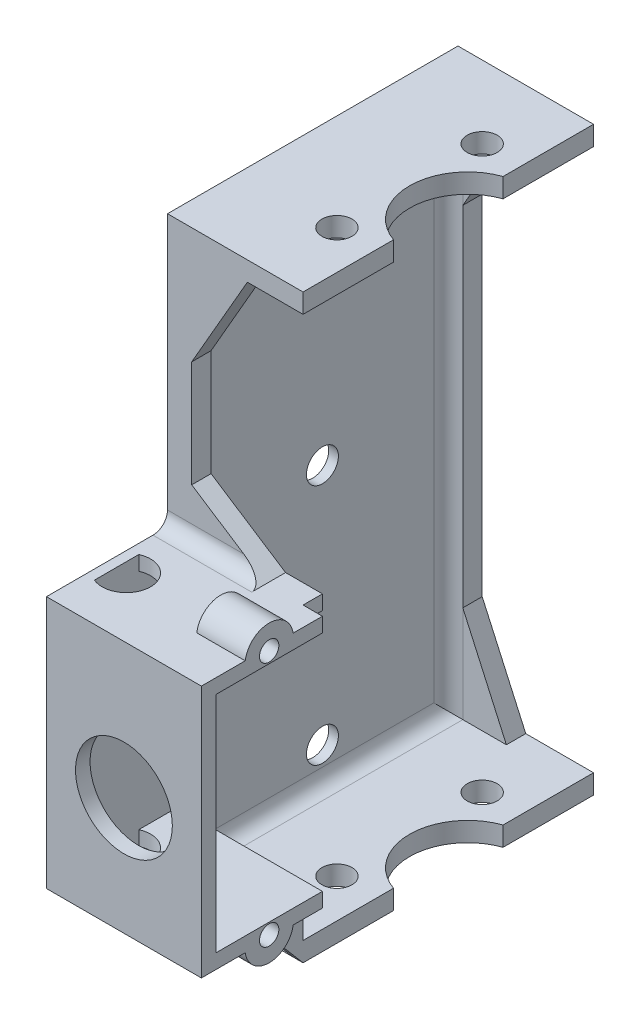
from build123d import *
from build123d.topology import SkipClean

# Parameters (mm, degrees)
CROQUIS1_R               = 1.65
SALIENTE_EXTRUIR1_DEPTH  = 1
CROQUIS3_W               = 30
CROQUIS3_H               = 2
SALIENTE_EXTRUIR2_DEPTH  = 13
CROQUIS4_R               = 1.55
CORTAR_EXTRUIR1_DEPTH    = 64.41135545
CROQUIS8_W               = 11
CROQUIS8_H               = 23.108
SALIENTE_EXTRUIR4_DEPTH  = 1
SALIENTE_EXTRUIR5_DEPTH  = 16
CORTAR_EXTRUIR2_DEPTH    = 46.124826869
SALIENTE_EXTRUIR6_DEPTH  = 5
CROQUIS12_R              = 1
CORTAR_EXTRUIR3_DEPTH    = 5
CROQUIS13_W              = 2
CROQUIS13_H              = 56
SALIENTE_EXTRUIR7_DEPTH  = 1.5
SALIENTE_EXTRUIR8_DEPTH  = 2
CROQUIS15_W              = 2
CROQUIS15_H              = 1.5
SALIENTE_EXTRUIR9_DEPTH  = 5
NERVIO4_REACH            = 54.69
CROQUIS16_WALL_W         = 115.107854894
CROQUIS16_WALL_H         = 1
NERVIO5_REACH            = 56.037
CROQUIS17_WALL_W         = 121.609320684
CROQUIS17_WALL_H         = 2
SALIENTE_EXTRUIR10_DEPTH = 1
MATRIZL1_COUNT           = 2
MATRIZL1_PITCH           = 6
NERVIO9_REACH            = 63.857
CROQUIS19_WALL_W         = 137.248650414
CROQUIS19_WALL_H         = 2
NERVIO10_REACH           = 63.857
CROQUIS20_WALL_W         = 136.67923452
CROQUIS20_WALL_H         = 2
REDONDEO1_R              = 1.5
CROQUIS21_R              = 5
CORTAR_EXTRUIR4_DEPTH    = 2


with BuildPart() as part:
    # Croquis1 → Saliente-Extruir1 (new body)
    with BuildSketch(Plane(origin=(0, 0, 0), x_dir=(0, 0, -1), z_dir=(1, 0, 0))):
        Polygon((-15, 18), (-15, -18), (15, -18), (15, 18), (15, 42), (-15, 42), align=None)
        with Locations((0, 12.5)):
            Circle(CROQUIS1_R, mode=Mode.SUBTRACT)
        with Locations((0, -12.5)):
            Circle(CROQUIS1_R, mode=Mode.SUBTRACT)
    extrude(amount=SALIENTE_EXTRUIR1_DEPTH)

    # Croquis3 → Saliente-Extruir2 (add)
    with BuildSketch(Plane(origin=(1, 0, 0), x_dir=(0, 0, -1), z_dir=(1, 0, 0))):
        with Locations((0, 41)):
            Rectangle(CROQUIS3_W, CROQUIS3_H)
        with Locations((0, -17)):
            Rectangle(CROQUIS3_W, CROQUIS3_H)
    extrude(amount=SALIENTE_EXTRUIR2_DEPTH)

    # Croquis4 → Cortar-Extruir1 (cut, through all)
    with BuildSketch(Plane(origin=(0, 42, 0), x_dir=(1, 0, 0), z_dir=(0, 1, 0))):
        with Locations(Location((10, 7.5, 0), (0, 0, 270))):
            Circle(CROQUIS4_R)
        with Locations(Location((10, -7.5, 0), (0, 0, 270))):
            Circle(CROQUIS4_R)
        with BuildLine():
            Line((14, 5.656854249), (14, -5.656854249))
            ThreePointArc((14, -5.656854249), (10, 0), (14, 5.656854249))
        make_face()
    extrude(amount=-CORTAR_EXTRUIR1_DEPTH, mode=Mode.SUBTRACT)

    # Croquis8 → Saliente-Extruir4 (add)
    with BuildSketch(Plane(origin=(0, 0, 0), x_dir=(0, 0, -1), z_dir=(1, 0, 0))):
        with Locations((-20.5, 0.946)):
            Rectangle(CROQUIS8_W, CROQUIS8_H)
    extrude(amount=SALIENTE_EXTRUIR4_DEPTH)

    # Croquis9 → Saliente-Extruir5 (add)
    with BuildSketch(Plane(origin=(0, 0, 0), x_dir=(0, 0, -1), z_dir=(1, 0, 0))):
        Polygon((-26, -10.608), (-26, 12.5), (-15, 12.5), (-15, 14), (-27.5, 14), (-27.5, -12.108), (-15, -12.108), (-15, -10.608), align=None)
    extrude(amount=SALIENTE_EXTRUIR5_DEPTH)

    # Croquis10 → Cortar-Extruir2 (cut, through all)
    with BuildSketch(Plane(origin=(0, 14, 0), x_dir=(1, 0, 0), z_dir=(0, 1, 0))):
        with BuildLine():
            ThreePointArc((4.5, -21.25), (3.369306394, -19.158349934), (1, -18.958712153))
            Line((1, -18.958712153), (1, -23.541287847))
            ThreePointArc((1, -23.541287847), (3.369306394, -23.341650066), (4.5, -21.25))
        make_face()
    extrude(amount=-CORTAR_EXTRUIR2_DEPTH, mode=Mode.SUBTRACT)

    # Croquis11 → Saliente-Extruir6 (add)
    with BuildSketch(Plane(origin=(16, 0, 0), x_dir=(0, 0, -1), z_dir=(1, 0, 0))):
        with BuildLine():
            Line((-21.435245422, -12.108), (-22.974809892, -12.108))
            ThreePointArc((-22.974809892, -12.108), (-20.5, -14.254), (-18.025190108, -12.108))
            Line((-18.025190108, -12.108), (-19.564754578, -12.108))
            ThreePointArc((-19.564754578, -12.108), (-20.5, -12.754), (-21.435245422, -12.108))
        make_face()
        with BuildLine():
            ThreePointArc((-18.025190108, 14), (-20.5, 16.146), (-22.974809892, 14))
            Line((-22.974809892, 14), (-21.435245422, 14))
            ThreePointArc((-21.435245422, 14), (-20.5, 14.646), (-19.564754578, 14))
            Line((-19.564754578, 14), (-18.025190108, 14))
        make_face()
    extrude(amount=-SALIENTE_EXTRUIR6_DEPTH)

    # Croquis12 → Cortar-Extruir3 (cut)
    with BuildSketch(Plane(origin=(16, 0, 0), x_dir=(0, 0, -1), z_dir=(1, 0, 0))):
        with Locations((-20.5, -11.754)):
            Circle(CROQUIS12_R)
        with Locations((-20.5, 13.646)):
            Circle(CROQUIS12_R)
    extrude(amount=-CORTAR_EXTRUIR3_DEPTH, mode=Mode.SUBTRACT)

    # Croquis13 → Saliente-Extruir7 (add)
    with BuildSketch(Plane(origin=(1, 0, 0), x_dir=(0, 0, -1), z_dir=(1, 0, 0))):
        with Locations((-14, 12)):
            Rectangle(CROQUIS13_W, CROQUIS13_H)
        with Locations((14, 12)):
            Rectangle(CROQUIS13_W, CROQUIS13_H)
    extrude(amount=SALIENTE_EXTRUIR7_DEPTH)

    # Croquis14 → Saliente-Extruir8 (add)
    with BuildSketch(Plane(origin=(0, 0, 15), x_dir=(-1, 0, 0), z_dir=(0, 0, -1))):
        Polygon((-12.5, 12.5), (-2.5, 19), (-2.5, 12.5), align=None)
    extrude(amount=SALIENTE_EXTRUIR8_DEPTH)

    # Croquis15 → Saliente-Extruir9 (add)
    with BuildSketch(Plane(origin=(14, 0, 0), x_dir=(0, 0, -1), z_dir=(1, 0, 0))):
        with Locations((-14, 13.25)):
            Rectangle(CROQUIS15_W, CROQUIS15_H)
    extrude(amount=-SALIENTE_EXTRUIR9_DEPTH)

    # Croquis16 wall → Nervio4 (add, up to next)
    with BuildSketch(Plane(origin=(0, -15.054, 17.5), x_dir=(0, -0.76246270462, -0.647032166174), z_dir=(0, -0.647032166174, 0.76246270462)), mode=Mode.PRIVATE) as nervio4_sk1:
        with Locations((0, 0.5)):
            Rectangle(CROQUIS16_WALL_W, CROQUIS16_WALL_H)
    nervio4_tool1 = extrude(nervio4_sk1.sketch, amount=-NERVIO4_REACH, mode=Mode.PRIVATE) - part.part
    add(nervio4_tool1.solids().sort_by_distance((0, -15.054, 17.5))[0])

    # Croquis17 wall → Nervio5 (add, up to next)
    with BuildSketch(Plane(origin=(5.375, 35, 15), x_dir=(-0.498471124258, -0.866906303058, 0), z_dir=(0.866906303058, -0.498471124258, 0)), mode=Mode.PRIVATE) as nervio5_sk1:
        with Locations((0, 1)):
            Rectangle(CROQUIS17_WALL_W, CROQUIS17_WALL_H)
    nervio5_tool1 = extrude(nervio5_sk1.sketch, amount=-NERVIO5_REACH, mode=Mode.PRIVATE) - part.part
    add(nervio5_tool1.solids().sort_by_distance((5.375, 35, 15))[0])

    # Croquis18 → Saliente-Extruir10 (add)
    with SkipClean():  # the faces are left unmerged after this step: merging them gives an invalid solid
        with BuildSketch(Plane(origin=(14, 0, 0), x_dir=(0, 0, -1), z_dir=(1, 0, 0))):
            with BuildLine():
                Line((-15, -18), (-19.744471073, -12.409115288))
                ThreePointArc((-19.744471073, -12.409115288), (-19.641310837, -12.266496752), (-19.564754578, -12.108))
                Line((-19.564754578, -12.108), (-15, -12.108))
                Line((-15, -12.108), (-15, -18))
            make_face()
        saliente_extruir10 = extrude(amount=-SALIENTE_EXTRUIR10_DEPTH)

    # MatrizL1: Saliente-Extruir10 ×2
    with SkipClean():  # the faces are left unmerged after this step: merging them gives an invalid solid
        with Locations(*[(-i * MATRIZL1_PITCH, 0, 0) for i in range(1, MATRIZL1_COUNT)]):
            add(saliente_extruir10)

    # Croquis19 wall → Nervio9 (add, up to next)
    with BuildSketch(Plane(origin=(5.375, 35, -15), x_dir=(-0.498471124258, -0.866906303058, 0), z_dir=(-0.866906303058, 0.498471124258, 0)), mode=Mode.PRIVATE) as nervio9_sk1:
        with Locations((0, 1)):
            Rectangle(CROQUIS19_WALL_W, CROQUIS19_WALL_H)
    nervio9_tool1 = extrude(nervio9_sk1.sketch, amount=NERVIO9_REACH, mode=Mode.PRIVATE) - part.part
    add(nervio9_tool1.solids().sort_by_distance((5.375, 35, -15))[0])

    # Croquis20 wall → Nervio10 (add, up to next)
    with BuildSketch(Plane(origin=(4.75, -11, -15), x_dir=(-0.410364677329, 0.911921505175, 0), z_dir=(0.911921505175, 0.410364677329, 0)), mode=Mode.PRIVATE) as nervio10_sk1:
        with Locations((0, 1)):
            Rectangle(CROQUIS20_WALL_W, CROQUIS20_WALL_H)
    nervio10_tool1 = extrude(nervio10_sk1.sketch, amount=-NERVIO10_REACH, mode=Mode.PRIVATE) - part.part
    add(nervio10_tool1.solids().sort_by_distance((4.75, -11, -15))[0])

    # Redondeo1
    redondeo1_edges = [part.edges().sort_by_distance(p)[0] for p in [
        (5.096153846, 14, 15),
        (1, 40, 0),
        (1, 12, 13),
        (1, -16, 0),
        (1, 12, -13),
    ]]
    fillet(redondeo1_edges, radius=REDONDEO1_R - 0.0001)  # a hair under: the kernel refuses the full size

    # Croquis21 → Cortar-Extruir4 (cut)
    with BuildSketch(Plane.XY.offset(27.5)):
        with Locations((8, 0)):
            Circle(CROQUIS21_R)
    extrude(amount=-CORTAR_EXTRUIR4_DEPTH, mode=Mode.SUBTRACT)


solid = part.part
